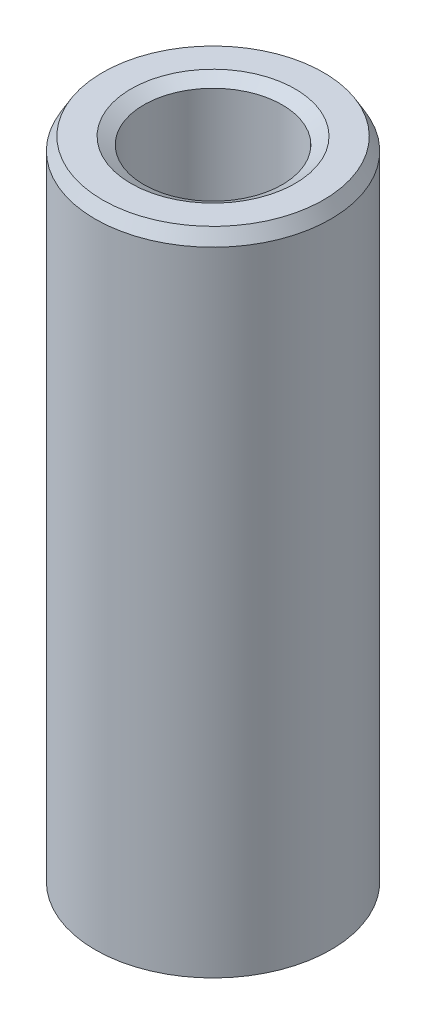
from build123d import *
from OCP.BRepFilletAPI import BRepFilletAPI_MakeChamfer

# Parameters (mm, degrees)
SKETCH1_R           = 22.5
BOSS_EXTRUDE1_DEPTH = 124.653891143
SKETCH2_R           = 13.208434258
CUT_EXTRUDE1_DEPTH  = 129.651049654
CHAMFER1_SIZE       = 2.450132511
CHAMFER1_SIZE2      = 1.414584665


with BuildPart() as part:
    # Sketch1 → Boss-Extrude1 (new body)
    with BuildSketch(Plane(origin=(0, 0, 0), x_dir=(1, 0, 0), z_dir=(0, 1, 0))):
        Circle(SKETCH1_R)
    extrude(amount=BOSS_EXTRUDE1_DEPTH)

    # Sketch2 → Cut-Extrude1 (cut, through all)
    with BuildSketch(Plane(origin=(0, 0, 0), x_dir=(1, 0, 0), z_dir=(0, 1, 0))):
        Circle(SKETCH2_R)
    extrude(amount=CUT_EXTRUDE1_DEPTH, mode=Mode.SUBTRACT)

    # Chamfer1: one chamfer whose edges measure the first distance from different faces: ONE call of the kernel's chamfer builder (chamfer() names one face for all edges)
    chamfer1_edges_1 = [part.edges().sort_by_distance(p)[0] for p in [
        (-13.208434258, 124.653891143, 0),
    ]]
    chamfer1_side_1 = [part.faces().sort_by_distance(p)[0] for p in [
        (-21.863603897, 124.653891143, 0),
    ]]
    chamfer1_edges_2 = [part.edges().sort_by_distance(p)[0] for p in [
        (-13.208434258, 0, 0),
    ]]
    chamfer1_side_2 = [part.faces().sort_by_distance(p)[0] for p in [
        (-13.208434258, 62.326945572, 0),
    ]]
    chamfer1_edges_3 = [part.edges().sort_by_distance(p)[0] for p in [
        (-22.5, 0, 0),
    ]]
    chamfer1_side_3 = [part.faces().sort_by_distance(p)[0] for p in [
        (-21.863603897, 0, 0),
    ]]
    chamfer1_edges_4 = [part.edges().sort_by_distance(p)[0] for p in [
        (-22.5, 124.653891143, 0),
    ]]
    chamfer1_side_4 = [part.faces().sort_by_distance(p)[0] for p in [
        (-22.5, 62.326945572, 0),
    ]]
    chamfer1 = BRepFilletAPI_MakeChamfer(part.part.solid().wrapped)
    for e in chamfer1_edges_1:
        chamfer1.Add(CHAMFER1_SIZE, CHAMFER1_SIZE2, e.wrapped, chamfer1_side_1[0].wrapped)  # the first distance lies on this face
    for e in chamfer1_edges_2:
        chamfer1.Add(CHAMFER1_SIZE, CHAMFER1_SIZE2, e.wrapped, chamfer1_side_2[0].wrapped)  # the first distance lies on this face
    for e in chamfer1_edges_3:
        chamfer1.Add(CHAMFER1_SIZE, CHAMFER1_SIZE2, e.wrapped, chamfer1_side_3[0].wrapped)  # the first distance lies on this face
    for e in chamfer1_edges_4:
        chamfer1.Add(CHAMFER1_SIZE, CHAMFER1_SIZE2, e.wrapped, chamfer1_side_4[0].wrapped)  # the first distance lies on this face
    add(Compound.cast(chamfer1.Shape()), mode=Mode.REPLACE)


solid = part.part
